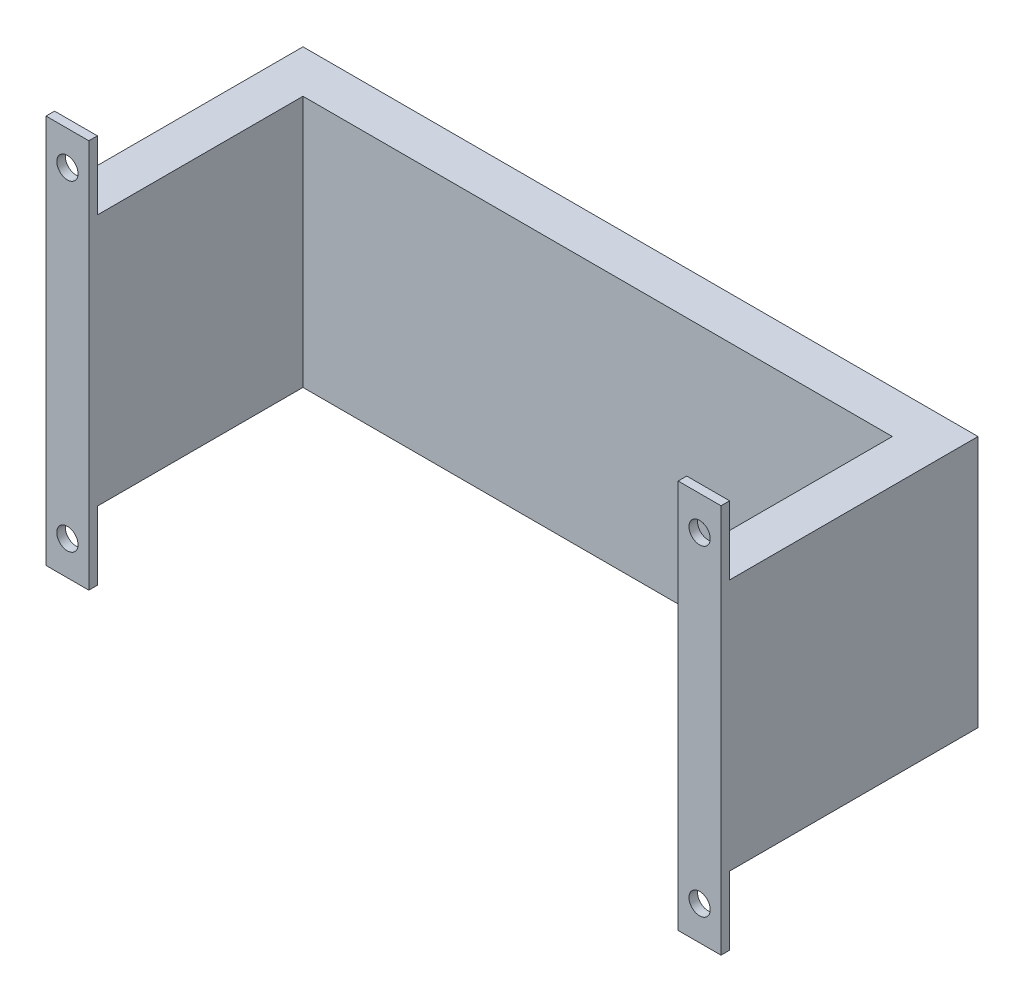
from build123d import *

# Parameters (mm, degrees)
SKETCH1_W           = 250.19
SKETCH1_H           = 93.472
BOSS_EXTRUDE1_DEPTH = 95.25
SKETCH5_W           = 218.44
SKETCH5_H           = 93.472
CUT_EXTRUDE1_DEPTH  = 79.375
SKETCH6_W           = 15.875
SKETCH6_H           = 25.4
BOSS_EXTRUDE2_DEPTH = 3.175
SKETCH7_R           = 3.937
CUT_EXTRUDE2_DEPTH  = 172.26052419


with BuildPart() as part:
    # Sketch1 → Boss-Extrude1 (new body)
    with BuildSketch(Plane.XY):
        Rectangle(SKETCH1_W, SKETCH1_H)
    extrude(amount=BOSS_EXTRUDE1_DEPTH)

    # Sketch5 → Cut-Extrude1 (cut)
    with BuildSketch(Plane.XY.offset(95.25)):
        Rectangle(SKETCH5_W, SKETCH5_H)
    extrude(amount=-CUT_EXTRUDE1_DEPTH, mode=Mode.SUBTRACT)

    # Sketch6 → Boss-Extrude2 (add)
    with BuildSketch(Plane.XY.offset(95.25)):
        with Locations((117.1575, 59.436)):
            Rectangle(SKETCH6_W, SKETCH6_H)
        with Locations((-117.1575, 59.436)):
            Rectangle(SKETCH6_W, SKETCH6_H)
        with Locations((117.1575, -59.436)):
            Rectangle(SKETCH6_W, SKETCH6_H)
        with Locations((-117.1575, -59.436)):
            Rectangle(SKETCH6_W, SKETCH6_H)
    extrude(amount=-BOSS_EXTRUDE2_DEPTH)

    # Sketch7 → Cut-Extrude2 (cut, through all)
    with BuildSketch(Plane(origin=(0, 0, 92.075), x_dir=(-1, 0, 0), z_dir=(0, 0, -1))):
        with Locations((117.1575, 59.5376)):
            Circle(SKETCH7_R)
        with Locations((-117.1575, 59.5376)):
            Circle(SKETCH7_R)
        with Locations((117.1575, -59.5376)):
            Circle(SKETCH7_R)
        with Locations((-117.1575, -59.5376)):
            Circle(SKETCH7_R)
    extrude(amount=-CUT_EXTRUDE2_DEPTH, mode=Mode.SUBTRACT)


solid = part.part
